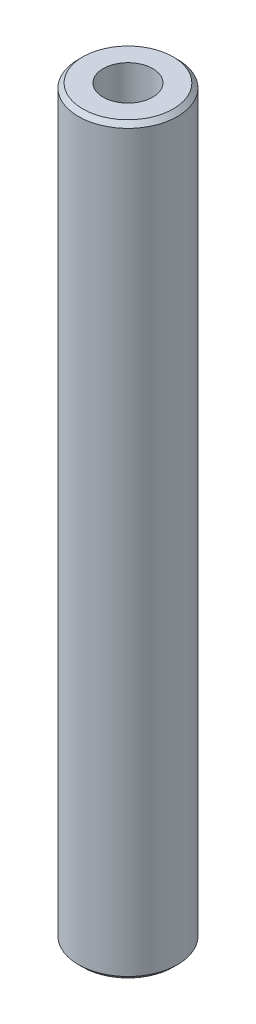
from build123d import *

# Parameters (mm, degrees)
SKETCH1_R           = 40
BOSS_EXTRUDE1_DEPTH = 600
SKETCH2_R           = 20.009939964
CUT_EXTRUDE1_DEPTH  = 603.660766933
CHAMFER1_SIZE       = 3.527922037


with BuildPart() as part:
    # Sketch1 → Boss-Extrude1 (new body)
    with BuildSketch(Plane(origin=(0, 0, 0), x_dir=(1, 0, 0), z_dir=(0, 1, 0))):
        Circle(SKETCH1_R)
    extrude(amount=BOSS_EXTRUDE1_DEPTH)

    # Sketch2 → Cut-Extrude1 (cut, through all)
    with BuildSketch(Plane(origin=(0, 0, 0), x_dir=(1, 0, 0), z_dir=(0, 1, 0))):
        Circle(SKETCH2_R)
    extrude(amount=CUT_EXTRUDE1_DEPTH, mode=Mode.SUBTRACT)

    # Chamfer1
    chamfer1_edges = [part.edges().sort_by_distance(p)[0] for p in [
        (-40, 600, 0),
        (-40, 0, 0),
    ]]
    chamfer(chamfer1_edges, length=CHAMFER1_SIZE)


solid = part.part
